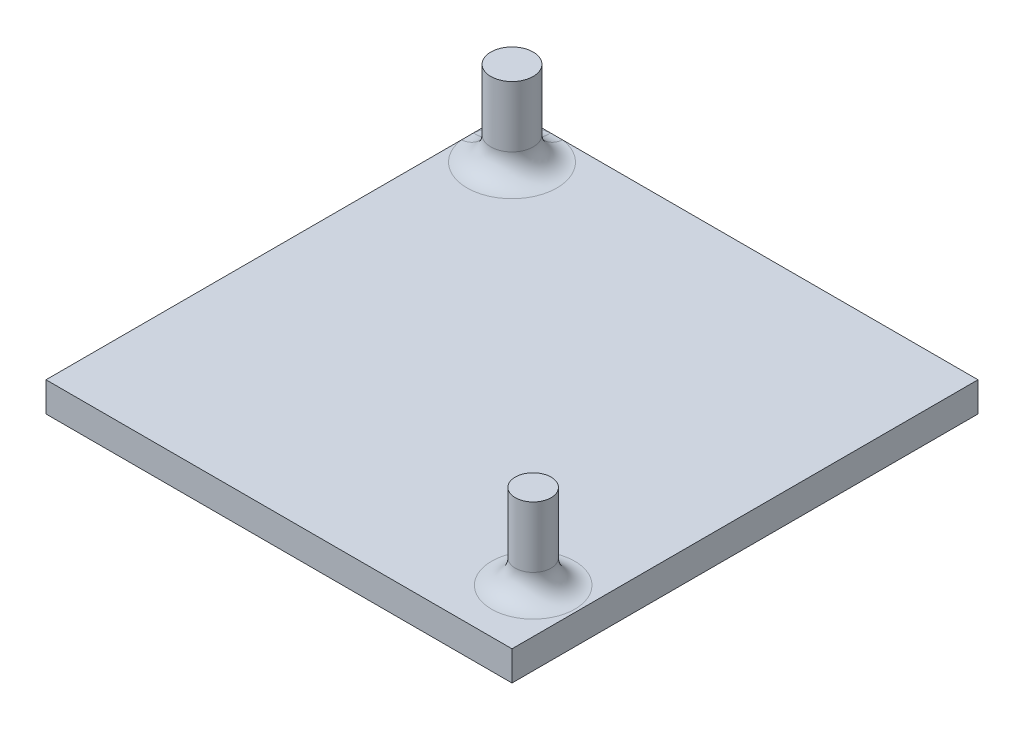
from build123d import *

# Parameters (mm, degrees)
SKETCH1_W           = 55
SKETCH1_H           = 55
BOSS_EXTRUDE1_DEPTH = 3.5
SKETCH2_R           = 2.5
SKETCH2_R_2         = 2.110567328
BOSS_EXTRUDE2_DEPTH = 10
FILLET1_R           = 2.8


with BuildPart() as part:
    # Sketch1 → Boss-Extrude1 (new body)
    with BuildSketch(Plane(origin=(0, 0, 0), x_dir=(1, 0, 0), z_dir=(0, 1, 0))):
        Rectangle(SKETCH1_W, SKETCH1_H)
    extrude(amount=BOSS_EXTRUDE1_DEPTH)

    # Sketch2 → Boss-Extrude2 (add)
    with BuildSketch(Plane(origin=(0, 3.5, 0), x_dir=(1, 0, 0), z_dir=(0, 1, 0))):
        with Locations((-22.25, 22.25)):
            Circle(SKETCH2_R)
        with Locations((22.25, -19.75)):
            Circle(SKETCH2_R_2)
    extrude(amount=BOSS_EXTRUDE2_DEPTH)

    # Fillet1
    fillet1_edges = [part.edges().sort_by_distance(p)[0] for p in [
        (20.139432672, 3.5, 19.75),
        (-24.75, 3.5, -22.25),
    ]]
    fillet(fillet1_edges, radius=FILLET1_R)


solid = part.part
